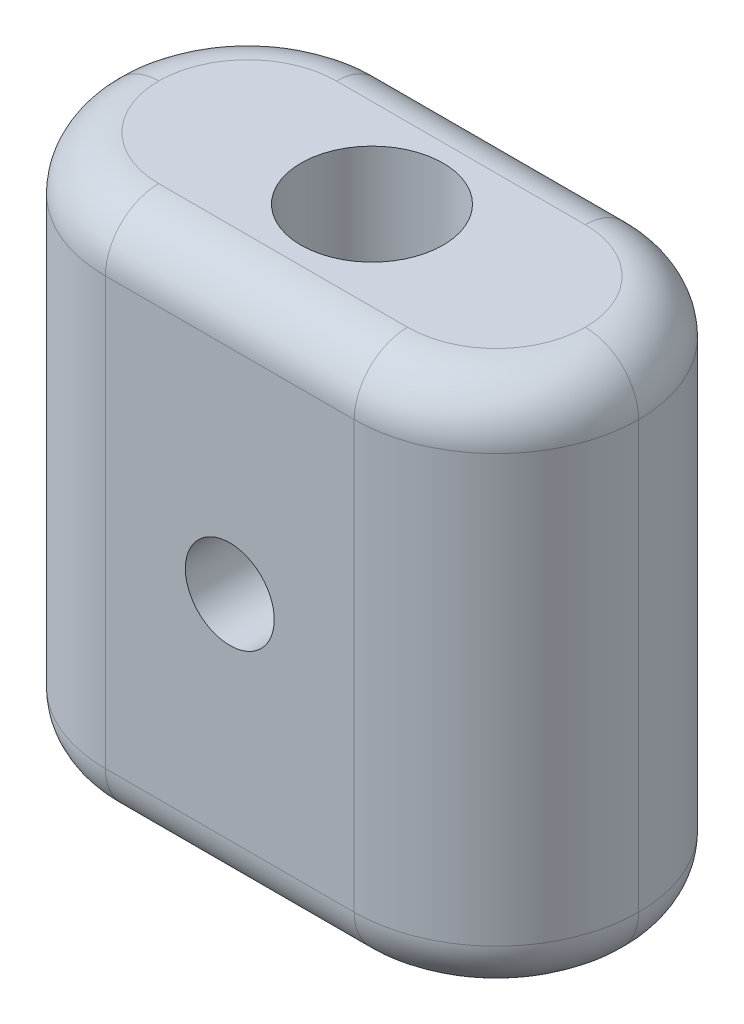
from build123d import *

# Parameters (mm, degrees)
SKETCH1_W           = 30
SKETCH1_H           = 30
BOSS_EXTRUDE1_DEPTH = 16
SKETCH2_R           = 2.5
CUT_EXTRUDE1_DEPTH  = 46.343136195
SKETCH3_R           = 4
CUT_EXTRUDE2_DEPTH  = 46.343136195
FILLET1_R           = 8
FILLET2_R           = 3


with BuildPart() as part:
    # Sketch1 → Boss-Extrude1 (new body)
    with BuildSketch(Plane.XY):
        with Locations((15, 15)):
            Rectangle(SKETCH1_W, SKETCH1_H)
    extrude(amount=BOSS_EXTRUDE1_DEPTH)

    # Sketch2 → Cut-Extrude1 (cut, through all)
    with BuildSketch(Plane(origin=(0, 0, 0), x_dir=(-1, 0, 0), z_dir=(0, 0, -1))):
        with Locations((-15, 15)):
            Circle(SKETCH2_R)
    extrude(amount=-CUT_EXTRUDE1_DEPTH, mode=Mode.SUBTRACT)

    # Sketch3 → Cut-Extrude2 (cut, through all)
    with BuildSketch(Plane(origin=(0, 30, 0), x_dir=(1, 0, 0), z_dir=(0, 1, 0))):
        with Locations(Location((15, -8, 0), (0, 0, 270))):
            Circle(SKETCH3_R)
    extrude(amount=-CUT_EXTRUDE2_DEPTH, mode=Mode.SUBTRACT)

    # Fillet1
    fillet1_edges = [part.edges().sort_by_distance(p)[0] for p in [
        (30, 15, 0),
        (30, 15, 16),
        (0, 15, 0),
        (0, 15, 16),
    ]]
    fillet(fillet1_edges, radius=FILLET1_R - 0.0001)  # a hair under: the kernel refuses the full size

    # Fillet2
    fillet2_edges = [part.edges().sort_by_distance(p)[0] for p in [
        (15, 30, 0),
        (15, 30, 16),
        (2.343116461, 30, 13.656883539),
        (2.343116461, 30, 2.343116461),
        (27.656883539, 30, 13.656883539),
        (27.656883539, 30, 2.343116461),
        (15, 0, 0),
        (15, 0, 16),
        (2.343116461, 0, 13.656883539),
        (2.343116461, 0, 2.343116461),
        (27.656883539, 0, 13.656883539),
        (27.656883539, 0, 2.343116461),
    ]]
    fillet(fillet2_edges, radius=FILLET2_R)


solid = part.part
